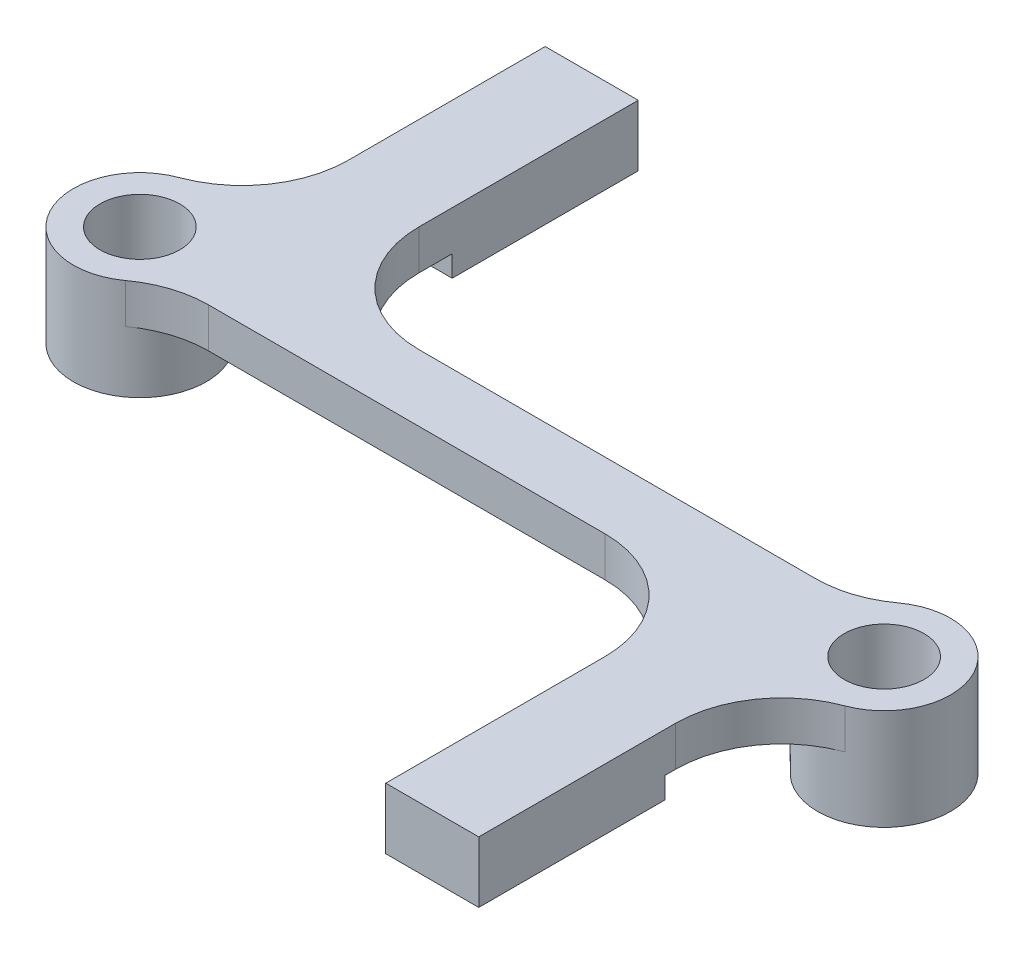
from build123d import *

# Parameters (mm, degrees)
SKETCH1_R           = 1.5
BOSS_EXTRUDE2_DEPTH = 3.8
BOSS_EXTRUDE3_START = -3.8
SKETCH2_W           = 3.5
SKETCH2_H           = 7
SKETCH2_H_2         = 5.25
BOSS_EXTRUDE3_DEPTH = 3.8
CUT_EXTRUDE1_DEPTH  = 2.3
SKETCH4_W           = 3.5
SKETCH4_H           = 7
CUT_EXTRUDE2_DEPTH  = 1.5
FILLET1_R           = 4


with BuildPart() as part:
    # Sketch1 → Boss-Extrude2 (new body)
    # profile 1 of 5: a face of its own
    with BuildSketch(Plane(origin=(0, 0, 0), x_dir=(1, 0, 0), z_dir=(0, 1, 0))):
        with BuildLine():
            Line((-11.834936491, -1.25), (-11.834936491, 1.25))
            ThreePointArc((-11.834936491, 1.25), (-16.5, 0), (-11.834936491, -1.25))
        make_face()
        with Locations(Location((-14, 0, 0), (0, 0, 90))):
            Circle(SKETCH1_R, mode=Mode.SUBTRACT)
    # profile 2 of 5: a face of its own
    with BuildSketch(Plane(origin=(0, 0, 0), x_dir=(1, 0, 0), z_dir=(0, 1, 0))):
        with BuildLine():
            ThreePointArc((-11.5, 0), (-11.585185434, 0.647047613), (-11.834936491, 1.25))
            Line((-11.834936491, 1.25), (-11.834936491, -1.25))
            ThreePointArc((-11.834936491, -1.25), (-11.585185434, -0.647047613), (-11.5, 0))
        make_face()
    # profile 3 of 5: a face of its own
    with BuildSketch(Plane(origin=(0, 0, 0), x_dir=(1, 0, 0), z_dir=(0, 1, 0))):
        with BuildLine():
            Line((11.834936491, 1.25), (-11.834936491, 1.25))
            ThreePointArc((-11.834936491, 1.25), (-11.585185434, 0.647047613), (-11.5, 0))
            ThreePointArc((-11.5, 0), (-11.585185434, -0.647047613), (-11.834936491, -1.25))
            Line((-11.834936491, -1.25), (11.834936491, -1.25))
            ThreePointArc((11.834936491, -1.25), (11.5, 0), (11.834936491, 1.25))
        make_face()
    # profile 4 of 5: a face of its own
    with BuildSketch(Plane(origin=(0, 0, 0), x_dir=(1, 0, 0), z_dir=(0, 1, 0))):
        with BuildLine():
            Line((11.834936491, -1.25), (11.834936491, 1.25))
            ThreePointArc((11.834936491, 1.25), (11.5, 0), (11.834936491, -1.25))
        make_face()
    # profile 5 of 5: a face of its own
    with BuildSketch(Plane(origin=(0, 0, 0), x_dir=(1, 0, 0), z_dir=(0, 1, 0))):
        with BuildLine():
            ThreePointArc((16.5, 0), (14.647047613, 2.414814566), (11.834936491, 1.25))
            Line((11.834936491, 1.25), (11.834936491, -1.25))
            ThreePointArc((11.834936491, -1.25), (14.647047613, -2.414814566), (16.5, 0))
        make_face()
        with Locations(Location((14, 0, 0), (0, 0, 90))):
            Circle(SKETCH1_R, mode=Mode.SUBTRACT)
    extrude(amount=BOSS_EXTRUDE2_DEPTH)

    # Sketch2 → Boss-Extrude3 (add)
    with BuildSketch(Plane(origin=(0, 3.8, 0), x_dir=(1, 0, 0), z_dir=(0, 1, 0)).offset(BOSS_EXTRUDE3_START)):
        with Locations((-10.5, 10)):
            Rectangle(SKETCH2_W, SKETCH2_H)
        with BuildLine():
            Line((-8.75, 6.5), (-12.25, 6.5))
            Line((-12.25, 6.5), (-12.25, 1.785357107))
            ThreePointArc((-12.25, 1.785357107), (-12.024251438, 1.531802083), (-11.834936491, 1.25))
            Line((-11.834936491, 1.25), (-8.75, 1.25))
            Line((-8.75, 1.25), (-8.75, 6.5))
        make_face()
        with Locations((10.5, -3.875)):
            Rectangle(SKETCH2_W, SKETCH2_H_2)
        with Locations((10.5, -10)):
            Rectangle(SKETCH2_W, SKETCH2_H)
    extrude(amount=BOSS_EXTRUDE3_DEPTH)

    # Sketch3 → Cut-Extrude1 (cut)
    with BuildSketch(Plane.XZ):
        with BuildLine():
            Line((11.834936491, 1.25), (8.75, 1.25))
            Line((8.75, 1.25), (-11.834936491, 1.25))
            ThreePointArc((-11.834936491, 1.25), (-11.585185434, 0.647047613), (-11.5, 0))
            ThreePointArc((-11.5, 0), (-11.585185434, -0.647047613), (-11.834936491, -1.25))
            Line((-11.834936491, -1.25), (-8.75, -1.25))
            Line((-8.75, -1.25), (11.834936491, -1.25))
            ThreePointArc((11.834936491, -1.25), (11.5, 0), (11.834936491, 1.25))
        make_face()
        with BuildLine():
            Line((12.25, 6.5), (8.75, 6.5))
            Line((8.75, 6.5), (8.75, 1.25))
            Line((8.75, 1.25), (11.834936491, 1.25))
            ThreePointArc((11.834936491, 1.25), (12.024251438, 1.531802083), (12.25, 1.785357107))
            Line((12.25, 1.785357107), (12.25, 6.5))
        make_face()
        with BuildLine():
            ThreePointArc((-11.834936491, -1.25), (-12.024251438, -1.531802083), (-12.25, -1.785357107))
            Line((-12.25, -1.785357107), (-12.25, -6.5))
            Line((-12.25, -6.5), (-8.75, -6.5))
            Line((-8.75, -6.5), (-8.75, -1.25))
            Line((-8.75, -1.25), (-11.834936491, -1.25))
        make_face()
    extrude(amount=-CUT_EXTRUDE1_DEPTH, mode=Mode.SUBTRACT)

    # Sketch4 → Cut-Extrude2 (cut)
    with BuildSketch(Plane.XZ):
        with Locations((-10.5, -10)):
            Rectangle(SKETCH4_W, SKETCH4_H)
        with Locations((10.5, 10)):
            Rectangle(SKETCH4_W, SKETCH4_H)
    extrude(amount=-CUT_EXTRUDE2_DEPTH, mode=Mode.SUBTRACT)

    # Fillet1
    # the kernel refuses this fillet: 4 mm, written as the material it adds along each edge
    with BuildSketch(Plane(origin=(11.834936491, 2.3, -1.25), x_dir=(-1, 0, 0), z_dir=(0, 1, 0))) as fillet1_piece_1:
        with BuildLine():
            CenterArc((1.66736392, -4), FILLET1_R, 90, 36.128927472)
            ThreePointArc((-0.69105296, -0.769230769), (-0.305320518, -0.420735169), (0, 0))
            Line((0, 0), (1.66736392, 0))
        make_face()
    extrude(amount=1.5)
    with BuildSketch(Plane(origin=(-11.834936491, 2.3, 1.25), x_dir=(-0.668294067479168, 0, 0.743897196776644), z_dir=(0, 1, 0))) as fillet1_piece_2:
        with BuildLine():
            CenterArc((1.861299371, 3.913523616), FILLET1_R, 221.935536264, 36.128927472)
            Line((-1.114289416, 1.240347346), (0, 0))
            ThreePointArc((0, 0), (0.517027603, 0.05404774), (1.034055206, 0))
        make_face()
    extrude(amount=1.5)
    with BuildSketch(Plane(origin=(8.75, 2.3, 1.25), x_dir=(-1, 0, 0), z_dir=(0, 1, 0))) as fillet1_piece_3:
        with BuildLine():
            CenterArc((FILLET1_R, FILLET1_R), FILLET1_R, 180, 90)
            Line((0, FILLET1_R), (0, 0))
            Line((0, 0), (FILLET1_R, 0))
        make_face()
    extrude(amount=1.5)
    with BuildSketch(Plane(origin=(12.25, 3.8, 1.785357107), x_dir=(0.9778293887496555, 0, 0.20940316735301484), z_dir=(0, -1, 0))) as fillet1_piece_4:
        with BuildLine():
            CenterArc((4.81443119, 3.379568307), FILLET1_R, 167.912621371, 69.747753258)
            Line((0.903113635, 4.217180976), (0, 0))
            ThreePointArc((0, 0), (1.337341997, 0.387769808), (2.674683994, 0))
        make_face()
    extrude(amount=1.5)
    with BuildSketch(Plane(origin=(-12.25, 2.3, -1.785357107), x_dir=(-0.9778293887496644, 0, -0.20940316735297415), z_dir=(0, 1, 0))) as fillet1_piece_5:
        with BuildLine():
            CenterArc((4.81443119, -3.379568307), FILLET1_R, 122.339625371, 69.747753258)
            Line((0.903113635, -4.217180976), (0, 0))
            ThreePointArc((0, 0), (1.337341997, -0.387769808), (2.674683994, 0))
        make_face()
    extrude(amount=1.5)
    with BuildSketch(Plane(origin=(-8.75, 2.3, -1.25), x_dir=(0, 0, -1), z_dir=(0, 1, 0))) as fillet1_piece_6:
        with BuildLine():
            CenterArc((FILLET1_R, -FILLET1_R), FILLET1_R, 90, 90)
            Line((0, -FILLET1_R), (0, 0))
            Line((0, 0), (FILLET1_R, 0))
        make_face()
    extrude(amount=1.5)


solid = part.part
